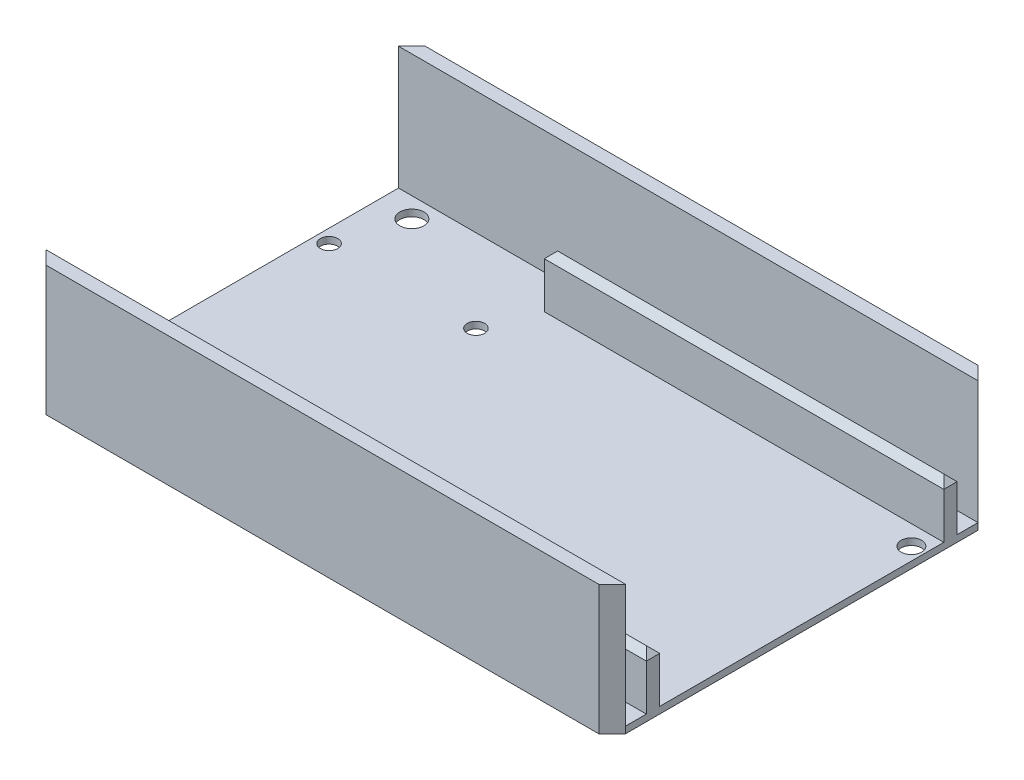
from build123d import *

# Parameters (mm, degrees)
SKETCH1_W               = 110.236
SKETCH1_H               = 72.136
RADIO_MOUNT_PLATE_DEPTH = 1.27
SKETCH2_R               = 1.95
SKETCH2_R_2             = 1.651
CUT_EXTRUDE1_DEPTH      = 132.746692907
SKETCH3_W               = 110.236
SKETCH3_H               = 2.54
BOSS_EXTRUDE2_DEPTH     = 23.37054
SKETCH4_R               = 2.286
CUT_EXTRUDE2_DEPTH      = 134.79746011
SKETCH5_W               = 76
SKETCH5_H               = 2.54
BOSS_EXTRUDE3_DEPTH     = 10
CHAMFER1_SIZE           = 1.27
CHAMFER2_SIZE           = 2.54


with BuildPart() as part:
    # Sketch1 → Radio Mount Plate (new body)
    with BuildSketch(Plane(origin=(0, 0, 0), x_dir=(1, 0, 0), z_dir=(0, 1, 0))):
        with Locations((55.118, 36.068)):
            Rectangle(SKETCH1_W, SKETCH1_H)
    extrude(amount=RADIO_MOUNT_PLATE_DEPTH)

    # Sketch2 → Cut-Extrude1 (cut, through all)
    with BuildSketch(Plane(origin=(0, 1.27, 0), x_dir=(1, 0, 0), z_dir=(0, 1, 0))):
        with Locations(Location((107.786, 59.368, 0), (0, 0, 270))):
            Circle(SKETCH2_R)
        with Locations(Location((38.036, 17.318, 0), (0, 0, 270))):
            Circle(SKETCH2_R)
        with Locations(Location((2.54, 53.848, 0), (0, 0, 270))):
            Circle(SKETCH2_R_2)
        with Locations(Location((30.48, 53.848, 0), (0, 0, 270))):
            Circle(SKETCH2_R_2)
        with Locations(Location((30.48, 18.288, 0), (0, 0, 270))):
            Circle(SKETCH2_R_2)
        with Locations(Location((2.54, 18.288, 0), (0, 0, 270))):
            Circle(SKETCH2_R_2)
    extrude(amount=-CUT_EXTRUDE1_DEPTH, mode=Mode.SUBTRACT)

    # Sketch3 → Boss-Extrude2 (add)
    with BuildSketch(Plane(origin=(0, 1.27, 0), x_dir=(1, 0, 0), z_dir=(0, 1, 0))):
        with Locations((55.118, 70.866)):
            Rectangle(SKETCH3_W, SKETCH3_H)
        with Locations((55.118, 1.27)):
            Rectangle(SKETCH3_W, SKETCH3_H)
    extrude(amount=BOSS_EXTRUDE2_DEPTH)

    # Sketch4 → Cut-Extrude2 (cut, through all)
    with BuildSketch(Plane(origin=(0, 1.27, 0), x_dir=(1, 0, 0), z_dir=(0, 1, 0))):
        with Locations(Location((6.35, 65.786, 0), (0, 0, 270))):
            Circle(SKETCH4_R)
        with Locations(Location((6.35, 6.35, 0), (0, 0, 90))):
            Circle(SKETCH4_R)
    extrude(amount=-CUT_EXTRUDE2_DEPTH, mode=Mode.SUBTRACT)

    # Sketch5 → Boss-Extrude3 (add)
    with BuildSketch(Plane(origin=(0, 1.27, 0), x_dir=(1, 0, 0), z_dir=(0, 1, 0))):
        with Locations((72.236, 64.358)):
            Rectangle(SKETCH5_W, SKETCH5_H)
        with Locations((72.236, 7.778)):
            Rectangle(SKETCH5_W, SKETCH5_H)
    extrude(amount=BOSS_EXTRUDE3_DEPTH)

    # Chamfer1
    chamfer1_edges = [part.edges().sort_by_distance(p)[0] for p in [
        (34.236, 11.27, -64.358),
        (72.236, 11.27, -63.088),
        (110.236, 11.27, -64.358),
        (72.236, 11.27, -65.628),
        (34.236, 11.27, -7.778),
        (72.236, 11.27, -6.508),
        (110.236, 11.27, -7.778),
        (72.236, 11.27, -9.048),
    ]]
    chamfer(chamfer1_edges, length=CHAMFER1_SIZE - 0.0001)  # a hair under: the kernel refuses the full size

    # Chamfer2
    chamfer2_edges = [part.edges().sort_by_distance(p)[0] for p in [
        (110.236, 12.32027, 0),
        (110.236, 12.32027, -72.136),
        (0, 12.32027, -72.136),
        (0, 12.32027, 0),
    ]]
    chamfer(chamfer2_edges, length=CHAMFER2_SIZE - 0.0001)  # a hair under: the kernel refuses the full size


solid = part.part
